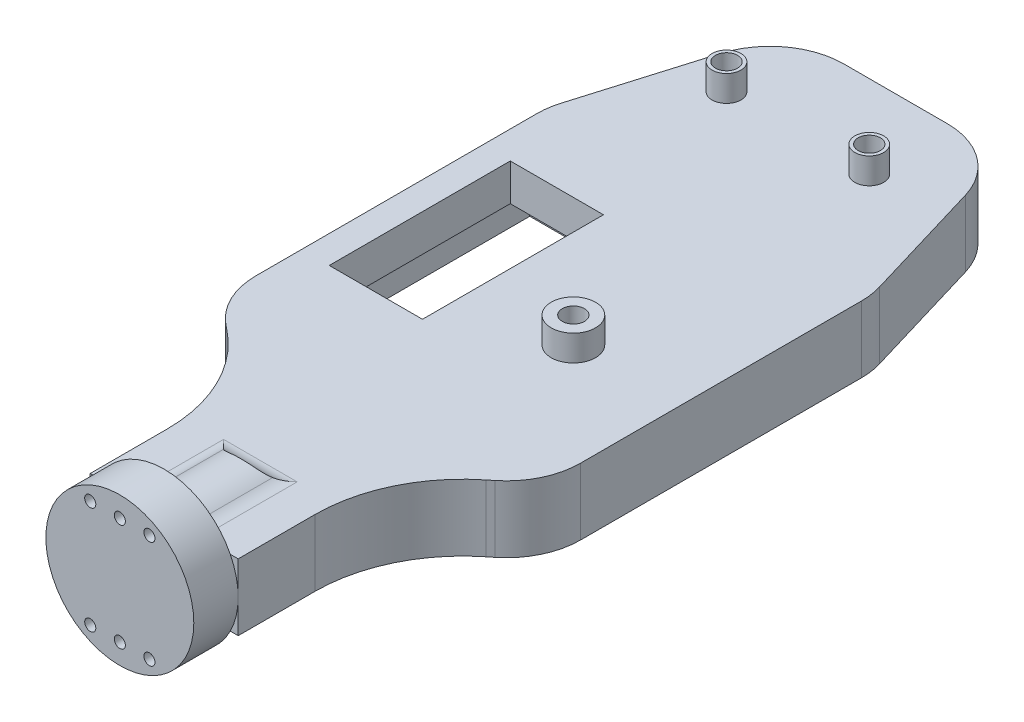
from build123d import *

# Parameters (mm, degrees)
SKETCH1_R           = 10
BOSS_EXTRUDE1_DEPTH = 6
SKETCH2_R           = 0.75
CUT_EXTRUDE1_DEPTH  = 15
SKETCH4_R           = 6
BOSS_EXTRUDE3_DEPTH = 10
SKETCH5_W           = 20
SKETCH5_H           = 20
BOSS_EXTRUDE4_DEPTH = 4.5
BOSS_EXTRUDE5_DEPTH = 9
SKETCH7_W           = 15
SKETCH7_H           = 35
CUT_EXTRUDE2_DEPTH  = 4
CUT_EXTRUDE3_DEPTH  = 14
CUT_EXTRUDE4_DEPTH  = 10
SKETCH11_R          = 1.95
SKETCH11_R_2        = 1.5
BOSS_EXTRUDE6_DEPTH = 3.5
SKETCH12_R          = 3
BOSS_EXTRUDE7_DEPTH = 3.5
SKETCH13_R          = 1.5
CUT_EXTRUDE5_DEPTH  = 25
FILLET1_R           = 20
FILLET2_R           = 10
FILLET3_R           = 3
FILLET4_R           = 3
FILLET5_R           = 3
FILLET6_R           = 3


with BuildPart() as part:
    # Sketch1 → Boss-Extrude1 (new body)
    with BuildSketch(Plane.XY):
        Circle(SKETCH1_R)
    extrude(amount=BOSS_EXTRUDE1_DEPTH)

    # Sketch2 → Cut-Extrude1 (cut)
    with BuildSketch(Plane.XY.offset(6)):
        with Locations((0, 7.25)):
            Circle(SKETCH2_R)
        with Locations((4, 7.25)):
            Circle(SKETCH2_R)
        with Locations((-4, 7.25)):
            Circle(SKETCH2_R)
        with Locations((4, -7.25)):
            Circle(SKETCH2_R)
        with Locations((0, -7.25)):
            Circle(SKETCH2_R)
        with Locations((-4, -7.25)):
            Circle(SKETCH2_R)
    extrude(amount=-CUT_EXTRUDE1_DEPTH, mode=Mode.SUBTRACT)

    # Sketch4 → Boss-Extrude3 (add)
    with BuildSketch(Plane(origin=(0, 0, 0), x_dir=(-1, 0, 0), z_dir=(0, 0, -1))):
        Circle(SKETCH4_R)
    extrude(amount=BOSS_EXTRUDE3_DEPTH)

    # Sketch5 → Boss-Extrude4 (add, symmetric)
    with BuildSketch(Plane(origin=(0, 0, 0), x_dir=(1, 0, 0), z_dir=(0, 1, 0))):
        with Locations((0, 10)):
            Rectangle(SKETCH5_W, SKETCH5_H)
    extrude(amount=BOSS_EXTRUDE4_DEPTH, both=True)

    # Sketch6 → Boss-Extrude5 (add)
    with BuildSketch(Plane(origin=(0, 4.5, 0), x_dir=(1, 0, 0), z_dir=(0, 1, 0))):
        Polygon((10, 20), (35.763212592, 40.556396064), (35.763212592, 98.883063355), (-35.763212592, 98.883063355), (-35.763212592, 40.556396064), (-10, 20), align=None)
    extrude(amount=-BOSS_EXTRUDE5_DEPTH)

    # Sketch7 → Cut-Extrude2 (cut)
    with BuildSketch(Plane.XZ.offset(4.5)):
        with Locations((-11.892304399, -51.30711123)):
            Rectangle(SKETCH7_W, SKETCH7_H)
    extrude(amount=-CUT_EXTRUDE2_DEPTH, mode=Mode.SUBTRACT)

    # Sketch8 → Cut-Extrude3 (cut)
    with BuildSketch(Plane.XZ.offset(0.5)):
        Polygon((-18.192304399, -55.774359721), (-18.192304399, -40.505749007), (-5.592304399, -40.505749007), (-5.592304399, -55.774359721), (-5.592304399, -64.974058921), (-18.192304399, -64.974058921), align=None)
    extrude(amount=-CUT_EXTRUDE3_DEPTH, mode=Mode.SUBTRACT)

    # Sketch10 → Cut-Extrude4 (cut)
    with BuildSketch(Plane.XZ.offset(4.5)):
        Polygon((-21.939786422, -73.769938093), (-14.445366372, -98.883063355), (-35.763212592, -98.883063355), (-35.763212592, -40.556396064), (-21.939786422, -29.526722559), align=None)
        Polygon((35.763212592, -40.556396064), (35.763212592, -98.883063355), (14.445366372, -98.883063355), (21.939786422, -73.769938093), (21.939786422, -29.526722559), align=None)
    extrude(amount=-CUT_EXTRUDE4_DEPTH, mode=Mode.SUBTRACT)

    # Sketch11 → Boss-Extrude6 (add)
    # profile 1 of 2: a face of its own
    with BuildSketch(Plane(origin=(0, 4.5, 0), x_dir=(1, 0, 0), z_dir=(0, 1, 0))):
        with Locations(Location((-11.689786422, 87.703063355, 0), (0, 0, 270))):
            Circle(SKETCH11_R)
        with Locations(Location((-11.689786422, 87.703063355, 0), (0, 0, 270))):
            Circle(SKETCH11_R_2, mode=Mode.SUBTRACT)
    # profile 2 of 2: a face of its own
    with BuildSketch(Plane(origin=(0, 4.5, 0), x_dir=(1, 0, 0), z_dir=(0, 1, 0))):
        with Locations(Location((7.610213578, 87.703063355, 0), (0, 0, 270))):
            Circle(SKETCH11_R)
        with Locations(Location((7.610213578, 87.703063355, 0), (0, 0, 270))):
            Circle(SKETCH11_R_2, mode=Mode.SUBTRACT)
    extrude(amount=BOSS_EXTRUDE6_DEPTH)

    # Sketch12 → Boss-Extrude7 (add)
    with BuildSketch(Plane(origin=(0, 4.5, 0), x_dir=(1, 0, 0), z_dir=(0, 1, 0))):
        with Locations(Location((7.610213578, 47.703063355, 0), (0, 0, 270))):
            Circle(SKETCH12_R)
    extrude(amount=BOSS_EXTRUDE7_DEPTH)

    # Sketch13 → Cut-Extrude5 (cut)
    with BuildSketch(Plane(origin=(0, 8, 0), x_dir=(1, 0, 0), z_dir=(0, 1, 0))):
        with Locations(Location((7.610213578, 47.703063355, 0), (0, 0, 270))):
            Circle(SKETCH13_R)
    extrude(amount=-CUT_EXTRUDE5_DEPTH, mode=Mode.SUBTRACT)

    # Fillet1
    fillet1_edges = [part.edges().sort_by_distance(p)[0] for p in [
        (10, 0, -20),
        (-10, 0, -20),
    ]]
    fillet(fillet1_edges, radius=FILLET1_R)

    # Fillet2
    fillet2_edges = [part.edges().sort_by_distance(p)[0] for p in [
        (-21.939786422, 0, -29.526722559),
        (-21.939786422, 0, -73.769938093),
        (-14.445366372, 0, -98.883063355),
        (21.939786422, 0, -29.526722559),
        (14.445366372, 0, -98.883063355),
        (21.939786422, 0, -73.769938093),
    ]]
    fillet(fillet2_edges, radius=FILLET2_R)

    # Fillet3
    # the kernel refuses this fillet: 3 mm, written as the material it adds along each edge
    with BuildSketch(Plane(origin=(11.468626967, 4.5, -10), x_dir=(0, 0, -1), z_dir=(-1, 0, 0))) as fillet3_piece_1_section:
        with BuildLine():
            CenterArc((FILLET3_R, -FILLET3_R), FILLET3_R, 90, 90)
            Line((0, -FILLET3_R), (0, 0))
            Line((0, 0), (FILLET3_R, 0))
        make_face()
    fillet3_piece_1 = extrude(amount=22.937253933, mode=Mode.PRIVATE)
    fillet3_piece_1 = fillet3_piece_1 & Plane(origin=(0, 0, -10.801783603), x_dir=(-1, 0, 0), z_dir=(0, 0, 1)) * Cylinder(6, 58, mode=Mode.PRIVATE)
    add(fillet3_piece_1)
    with BuildSketch(Plane(origin=(11.468626967, -4.5, -10), x_dir=(0, 0, -1), z_dir=(-1, 0, 0))) as fillet3_piece_2_section:
        with BuildLine():
            CenterArc((FILLET3_R, FILLET3_R), FILLET3_R, 180, 90)
            Line((0, FILLET3_R), (0, 0))
            Line((0, 0), (FILLET3_R, 0))
        make_face()
    fillet3_piece_2 = extrude(amount=22.937253933, mode=Mode.PRIVATE)
    fillet3_piece_2 = fillet3_piece_2 & Plane(origin=(0, 0, -10.801783603), x_dir=(-1, 0, 0), z_dir=(0, 0, 1)) * Cylinder(6, 58, mode=Mode.PRIVATE)
    add(fillet3_piece_2)

    # Fillet4
    fillet4_edges = [part.edges().sort_by_distance(p)[0] for p in [
        (3.968626967, 4.5, -6.5),
    ]]
    fillet(fillet4_edges, radius=FILLET4_R)

    # Fillet5
    fillet5_edges = [part.edges().sort_by_distance(p)[0] for p in [
        (-3.968626967, 4.5, -6.5),
    ]]
    fillet(fillet5_edges, radius=FILLET5_R)

    # Fillet6
    fillet6_edges = [part.edges().sort_by_distance(p)[0] for p in [
        (-3.968626967, -4.5, -6.5),
        (3.968626967, -4.5, -6.5),
    ]]
    fillet(fillet6_edges, radius=FILLET6_R)


solid = part.part
